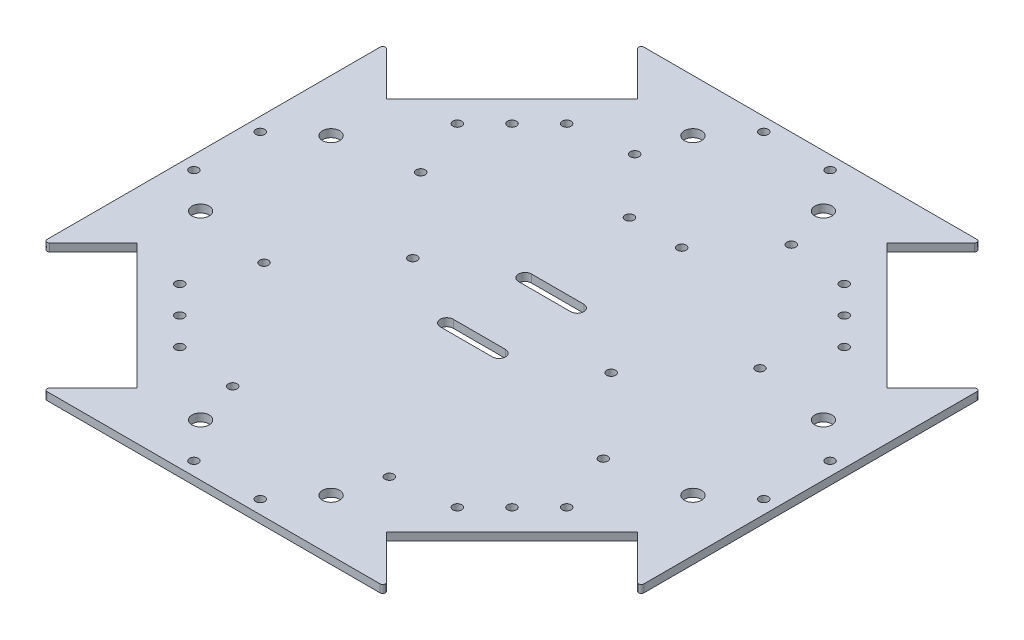
from build123d import *

# Parameters (mm, degrees)
SKETCH1_W                                   = 228.6
SKETCH1_H                                   = 228.6
PLATE_DEPTH                                 = 3
SKETCH8_R                                   = 1.7
MOTOR_MOUNT_HOLES_DEPTH                     = 3
SKETCH9_R                                   = 1.7
CONNECTOR_BOARD_HOLES_DEPTH                 = 3
MOTOR_CONTROLLER_HOLDER_ARDUINO_HOLES_REACH = 163.672
SKETCH11_R                                  = 1.7
CABLE_SLOTS_REACH                           = 163.672
WALL_BRACKET_HOLES_REACH                    = 163.672
SKETCH13_R                                  = 1.7
BATTERY_HOLDER_HOLES_REACH                  = 163.672
SKETCH14_R                                  = 1.7
LOAD_MOUNT_HOLES_REACH                      = 163.672
SKETCH15_R                                  = 3.3
LEVEL2_STANDOFF_HOLES_REACH                 = 163.672
SKETCH10_R                                  = 1.7
WHEEL_SLOTS_DEPTH                           = 3
FILLET1_R                                   = 1


with BuildPart() as part:
    # Sketch1 → plate (new body)
    with BuildSketch(Plane(origin=(0, 0, 0), x_dir=(1, 0, 0), z_dir=(0, 1, 0))):
        Rectangle(SKETCH1_W, SKETCH1_H)
    extrude(amount=PLATE_DEPTH)

    # Sketch8 → motor-mount-holes (cut)
    with BuildSketch(Plane(origin=(0, 3, 0), x_dir=(1, 0, 0), z_dir=(0, 1, 0))):
        with Locations((63.639610307, 63.639610307)):
            Circle(SKETCH8_R)
        with Locations((74.104790668, 53.174429945)):
            Circle(SKETCH8_R)
        with Locations((53.174429945, 74.104790668)):
            Circle(SKETCH8_R)
        with Locations((63.639610307, -63.639610307)):
            Circle(SKETCH8_R)
        with Locations((74.104790668, -53.174429945)):
            Circle(SKETCH8_R)
        with Locations((53.174429945, -74.104790668)):
            Circle(SKETCH8_R)
        with Locations((-63.639610307, -63.639610307)):
            Circle(SKETCH8_R)
        with Locations((-53.174429945, -74.104790668)):
            Circle(SKETCH8_R)
        with Locations((-74.104790668, -53.174429945)):
            Circle(SKETCH8_R)
        with Locations((-63.639610307, 63.639610307)):
            Circle(SKETCH8_R)
        with Locations((-74.104790668, 53.174429945)):
            Circle(SKETCH8_R)
        with Locations((-53.174429945, 74.104790668)):
            Circle(SKETCH8_R)
    extrude(amount=-MOTOR_MOUNT_HOLES_DEPTH, mode=Mode.SUBTRACT)

    # Sketch9 → connector-board-holes (cut)
    with BuildSketch(Plane(origin=(0, 3, 0), x_dir=(1, 0, 0), z_dir=(0, 1, 0))):
        with Locations((-38, 0)):
            Circle(SKETCH9_R)
        with Locations((38, 0)):
            Circle(SKETCH9_R)
    extrude(amount=-CONNECTOR_BOARD_HOLES_DEPTH, mode=Mode.SUBTRACT)

    # Sketch11 → motor-controller-holder-arduino-holes (cut, up to next)
    with BuildSketch(Plane(origin=(0, 3, 0), x_dir=(1, 0, 0), z_dir=(0, 1, 0)), mode=Mode.PRIVATE) as motor_controller_holder_arduino_holes_sk1:
        with Locations((-10, 55)):
            Circle(SKETCH11_R)
    motor_controller_holder_arduino_holes_tool1 = extrude(motor_controller_holder_arduino_holes_sk1.sketch, amount=-MOTOR_CONTROLLER_HOLDER_ARDUINO_HOLES_REACH, mode=Mode.PRIVATE) & part.part
    # Sketch11 → motor-controller-holder-arduino-holes (cut, up to next)
    with BuildSketch(Plane(origin=(0, 3, 0), x_dir=(1, 0, 0), z_dir=(0, 1, 0)), mode=Mode.PRIVATE) as motor_controller_holder_arduino_holes_sk2:
        with Locations((10, 55)):
            Circle(SKETCH11_R)
    motor_controller_holder_arduino_holes_tool2 = extrude(motor_controller_holder_arduino_holes_sk2.sketch, amount=-MOTOR_CONTROLLER_HOLDER_ARDUINO_HOLES_REACH, mode=Mode.PRIVATE) & part.part
    add(motor_controller_holder_arduino_holes_tool1.solids().sort_by_distance((-10, 3, -55))[0], mode=Mode.SUBTRACT)
    add(motor_controller_holder_arduino_holes_tool2.solids().sort_by_distance((10, 3, -55))[0], mode=Mode.SUBTRACT)

    # Sketch12 → cable-slots (cut, up to next)
    with BuildSketch(Plane(origin=(0, 3, 0), x_dir=(1, 0, 0), z_dir=(0, 1, 0)), mode=Mode.PRIVATE) as cable_slots_sk1:
        with BuildLine():
            Line((-10, 17.5), (10, 17.5))
            ThreePointArc((10, 17.5), (12.5, 15), (10, 12.5))
            Line((10, 12.5), (-10, 12.5))
            ThreePointArc((-10, 12.5), (-12.5, 15), (-10, 17.5))
        make_face()
    cable_slots_tool1 = extrude(cable_slots_sk1.sketch, amount=-CABLE_SLOTS_REACH, mode=Mode.PRIVATE) & part.part
    # Sketch12 → cable-slots (cut, up to next)
    with BuildSketch(Plane(origin=(0, 3, 0), x_dir=(1, 0, 0), z_dir=(0, 1, 0)), mode=Mode.PRIVATE) as cable_slots_sk2:
        with BuildLine():
            Line((-10, -12.5), (10, -12.5))
            ThreePointArc((10, -12.5), (12.5, -15), (10, -17.5))
            Line((10, -17.5), (-10, -17.5))
            ThreePointArc((-10, -17.5), (-12.5, -15), (-10, -12.5))
        make_face()
    cable_slots_tool2 = extrude(cable_slots_sk2.sketch, amount=-CABLE_SLOTS_REACH, mode=Mode.PRIVATE) & part.part
    add(cable_slots_tool1.solids().sort_by_distance((0, 3, -15))[0], mode=Mode.SUBTRACT)
    add(cable_slots_tool2.solids().sort_by_distance((0, 3, 15))[0], mode=Mode.SUBTRACT)

    # Sketch13 → wall-bracket-holes (cut, up to next)
    with BuildSketch(Plane(origin=(0, 3, 0), x_dir=(1, 0, 0), z_dir=(0, 1, 0)), mode=Mode.PRIVATE) as wall_bracket_holes_sk1:
        with Locations((-12.7, 109.1438)):
            Circle(SKETCH13_R)
    wall_bracket_holes_tool1 = extrude(wall_bracket_holes_sk1.sketch, amount=-WALL_BRACKET_HOLES_REACH, mode=Mode.PRIVATE) & part.part
    # Sketch13 → wall-bracket-holes (cut, up to next)
    with BuildSketch(Plane(origin=(0, 3, 0), x_dir=(1, 0, 0), z_dir=(0, 1, 0)), mode=Mode.PRIVATE) as wall_bracket_holes_sk2:
        with Locations((12.7, 109.1438)):
            Circle(SKETCH13_R)
    wall_bracket_holes_tool2 = extrude(wall_bracket_holes_sk2.sketch, amount=-WALL_BRACKET_HOLES_REACH, mode=Mode.PRIVATE) & part.part
    # Sketch13 → wall-bracket-holes (cut, up to next)
    with BuildSketch(Plane(origin=(0, 3, 0), x_dir=(1, 0, 0), z_dir=(0, 1, 0)), mode=Mode.PRIVATE) as wall_bracket_holes_sk3:
        with Locations((109.1438, 12.7)):
            Circle(SKETCH13_R)
    wall_bracket_holes_tool3 = extrude(wall_bracket_holes_sk3.sketch, amount=-WALL_BRACKET_HOLES_REACH, mode=Mode.PRIVATE) & part.part
    # Sketch13 → wall-bracket-holes (cut, up to next)
    with BuildSketch(Plane(origin=(0, 3, 0), x_dir=(1, 0, 0), z_dir=(0, 1, 0)), mode=Mode.PRIVATE) as wall_bracket_holes_sk4:
        with Locations((109.1438, -12.7)):
            Circle(SKETCH13_R)
    wall_bracket_holes_tool4 = extrude(wall_bracket_holes_sk4.sketch, amount=-WALL_BRACKET_HOLES_REACH, mode=Mode.PRIVATE) & part.part
    # Sketch13 → wall-bracket-holes (cut, up to next)
    with BuildSketch(Plane(origin=(0, 3, 0), x_dir=(1, 0, 0), z_dir=(0, 1, 0)), mode=Mode.PRIVATE) as wall_bracket_holes_sk5:
        with Locations((12.7, -109.1438)):
            Circle(SKETCH13_R)
    wall_bracket_holes_tool5 = extrude(wall_bracket_holes_sk5.sketch, amount=-WALL_BRACKET_HOLES_REACH, mode=Mode.PRIVATE) & part.part
    # Sketch13 → wall-bracket-holes (cut, up to next)
    with BuildSketch(Plane(origin=(0, 3, 0), x_dir=(1, 0, 0), z_dir=(0, 1, 0)), mode=Mode.PRIVATE) as wall_bracket_holes_sk6:
        with Locations((-12.7, -109.1438)):
            Circle(SKETCH13_R)
    wall_bracket_holes_tool6 = extrude(wall_bracket_holes_sk6.sketch, amount=-WALL_BRACKET_HOLES_REACH, mode=Mode.PRIVATE) & part.part
    # Sketch13 → wall-bracket-holes (cut, up to next)
    with BuildSketch(Plane(origin=(0, 3, 0), x_dir=(1, 0, 0), z_dir=(0, 1, 0)), mode=Mode.PRIVATE) as wall_bracket_holes_sk7:
        with Locations((-109.1438, -12.7)):
            Circle(SKETCH13_R)
    wall_bracket_holes_tool7 = extrude(wall_bracket_holes_sk7.sketch, amount=-WALL_BRACKET_HOLES_REACH, mode=Mode.PRIVATE) & part.part
    # Sketch13 → wall-bracket-holes (cut, up to next)
    with BuildSketch(Plane(origin=(0, 3, 0), x_dir=(1, 0, 0), z_dir=(0, 1, 0)), mode=Mode.PRIVATE) as wall_bracket_holes_sk8:
        with Locations((-109.1438, 12.7)):
            Circle(SKETCH13_R)
    wall_bracket_holes_tool8 = extrude(wall_bracket_holes_sk8.sketch, amount=-WALL_BRACKET_HOLES_REACH, mode=Mode.PRIVATE) & part.part
    add(wall_bracket_holes_tool1.solids().sort_by_distance((-12.7, 3, -109.1438))[0], mode=Mode.SUBTRACT)
    add(wall_bracket_holes_tool2.solids().sort_by_distance((12.7, 3, -109.1438))[0], mode=Mode.SUBTRACT)
    add(wall_bracket_holes_tool3.solids().sort_by_distance((109.1438, 3, -12.7))[0], mode=Mode.SUBTRACT)
    add(wall_bracket_holes_tool4.solids().sort_by_distance((109.1438, 3, 12.7))[0], mode=Mode.SUBTRACT)
    add(wall_bracket_holes_tool5.solids().sort_by_distance((12.7, 3, 109.1438))[0], mode=Mode.SUBTRACT)
    add(wall_bracket_holes_tool6.solids().sort_by_distance((-12.7, 3, 109.1438))[0], mode=Mode.SUBTRACT)
    add(wall_bracket_holes_tool7.solids().sort_by_distance((-109.1438, 3, 12.7))[0], mode=Mode.SUBTRACT)
    add(wall_bracket_holes_tool8.solids().sort_by_distance((-109.1438, 3, -12.7))[0], mode=Mode.SUBTRACT)

    # Sketch14 → battery-holder-holes (cut, up to next)
    with BuildSketch(Plane(origin=(0, 3, 0), x_dir=(1, 0, 0), z_dir=(0, 1, 0)), mode=Mode.PRIVATE) as battery_holder_holes_sk1:
        with Locations((-65, 30)):
            Circle(SKETCH14_R)
    battery_holder_holes_tool1 = extrude(battery_holder_holes_sk1.sketch, amount=-BATTERY_HOLDER_HOLES_REACH, mode=Mode.PRIVATE) & part.part
    # Sketch14 → battery-holder-holes (cut, up to next)
    with BuildSketch(Plane(origin=(0, 3, 0), x_dir=(1, 0, 0), z_dir=(0, 1, 0)), mode=Mode.PRIVATE) as battery_holder_holes_sk2:
        with Locations((-65, -30)):
            Circle(SKETCH14_R)
    battery_holder_holes_tool2 = extrude(battery_holder_holes_sk2.sketch, amount=-BATTERY_HOLDER_HOLES_REACH, mode=Mode.PRIVATE) & part.part
    # Sketch14 → battery-holder-holes (cut, up to next)
    with BuildSketch(Plane(origin=(0, 3, 0), x_dir=(1, 0, 0), z_dir=(0, 1, 0)), mode=Mode.PRIVATE) as battery_holder_holes_sk3:
        with Locations((65, -30)):
            Circle(SKETCH14_R)
    battery_holder_holes_tool3 = extrude(battery_holder_holes_sk3.sketch, amount=-BATTERY_HOLDER_HOLES_REACH, mode=Mode.PRIVATE) & part.part
    # Sketch14 → battery-holder-holes (cut, up to next)
    with BuildSketch(Plane(origin=(0, 3, 0), x_dir=(1, 0, 0), z_dir=(0, 1, 0)), mode=Mode.PRIVATE) as battery_holder_holes_sk4:
        with Locations((65, 30)):
            Circle(SKETCH14_R)
    battery_holder_holes_tool4 = extrude(battery_holder_holes_sk4.sketch, amount=-BATTERY_HOLDER_HOLES_REACH, mode=Mode.PRIVATE) & part.part
    add(battery_holder_holes_tool1.solids().sort_by_distance((-65, 3, -30))[0], mode=Mode.SUBTRACT)
    add(battery_holder_holes_tool2.solids().sort_by_distance((-65, 3, 30))[0], mode=Mode.SUBTRACT)
    add(battery_holder_holes_tool3.solids().sort_by_distance((65, 3, 30))[0], mode=Mode.SUBTRACT)
    add(battery_holder_holes_tool4.solids().sort_by_distance((65, 3, -30))[0], mode=Mode.SUBTRACT)

    # Sketch15 → load-mount-holes (cut, up to next)
    with BuildSketch(Plane(origin=(0, 3, 0), x_dir=(1, 0, 0), z_dir=(0, 1, 0)), mode=Mode.PRIVATE) as load_mount_holes_sk1:
        with Locations((-94.3, 25)):
            Circle(SKETCH15_R)
    load_mount_holes_tool1 = extrude(load_mount_holes_sk1.sketch, amount=-LOAD_MOUNT_HOLES_REACH, mode=Mode.PRIVATE) & part.part
    # Sketch15 → load-mount-holes (cut, up to next)
    with BuildSketch(Plane(origin=(0, 3, 0), x_dir=(1, 0, 0), z_dir=(0, 1, 0)), mode=Mode.PRIVATE) as load_mount_holes_sk2:
        with Locations((-94.3, -25)):
            Circle(SKETCH15_R)
    load_mount_holes_tool2 = extrude(load_mount_holes_sk2.sketch, amount=-LOAD_MOUNT_HOLES_REACH, mode=Mode.PRIVATE) & part.part
    # Sketch15 → load-mount-holes (cut, up to next)
    with BuildSketch(Plane(origin=(0, 3, 0), x_dir=(1, 0, 0), z_dir=(0, 1, 0)), mode=Mode.PRIVATE) as load_mount_holes_sk3:
        with Locations((94.3, 25)):
            Circle(SKETCH15_R)
    load_mount_holes_tool3 = extrude(load_mount_holes_sk3.sketch, amount=-LOAD_MOUNT_HOLES_REACH, mode=Mode.PRIVATE) & part.part
    # Sketch15 → load-mount-holes (cut, up to next)
    with BuildSketch(Plane(origin=(0, 3, 0), x_dir=(1, 0, 0), z_dir=(0, 1, 0)), mode=Mode.PRIVATE) as load_mount_holes_sk4:
        with Locations((94.3, -25)):
            Circle(SKETCH15_R)
    load_mount_holes_tool4 = extrude(load_mount_holes_sk4.sketch, amount=-LOAD_MOUNT_HOLES_REACH, mode=Mode.PRIVATE) & part.part
    # Sketch15 → load-mount-holes (cut, up to next)
    with BuildSketch(Plane(origin=(0, 3, 0), x_dir=(1, 0, 0), z_dir=(0, 1, 0)), mode=Mode.PRIVATE) as load_mount_holes_sk5:
        with Locations((25, 94.3)):
            Circle(SKETCH15_R)
    load_mount_holes_tool5 = extrude(load_mount_holes_sk5.sketch, amount=-LOAD_MOUNT_HOLES_REACH, mode=Mode.PRIVATE) & part.part
    # Sketch15 → load-mount-holes (cut, up to next)
    with BuildSketch(Plane(origin=(0, 3, 0), x_dir=(1, 0, 0), z_dir=(0, 1, 0)), mode=Mode.PRIVATE) as load_mount_holes_sk6:
        with Locations((-25, 94.3)):
            Circle(SKETCH15_R)
    load_mount_holes_tool6 = extrude(load_mount_holes_sk6.sketch, amount=-LOAD_MOUNT_HOLES_REACH, mode=Mode.PRIVATE) & part.part
    # Sketch15 → load-mount-holes (cut, up to next)
    with BuildSketch(Plane(origin=(0, 3, 0), x_dir=(1, 0, 0), z_dir=(0, 1, 0)), mode=Mode.PRIVATE) as load_mount_holes_sk7:
        with Locations((25, -94.3)):
            Circle(SKETCH15_R)
    load_mount_holes_tool7 = extrude(load_mount_holes_sk7.sketch, amount=-LOAD_MOUNT_HOLES_REACH, mode=Mode.PRIVATE) & part.part
    # Sketch15 → load-mount-holes (cut, up to next)
    with BuildSketch(Plane(origin=(0, 3, 0), x_dir=(1, 0, 0), z_dir=(0, 1, 0)), mode=Mode.PRIVATE) as load_mount_holes_sk8:
        with Locations((-25, -94.3)):
            Circle(SKETCH15_R)
    load_mount_holes_tool8 = extrude(load_mount_holes_sk8.sketch, amount=-LOAD_MOUNT_HOLES_REACH, mode=Mode.PRIVATE) & part.part
    add(load_mount_holes_tool1.solids().sort_by_distance((-94.3, 3, -25))[0], mode=Mode.SUBTRACT)
    add(load_mount_holes_tool2.solids().sort_by_distance((-94.3, 3, 25))[0], mode=Mode.SUBTRACT)
    add(load_mount_holes_tool3.solids().sort_by_distance((94.3, 3, -25))[0], mode=Mode.SUBTRACT)
    add(load_mount_holes_tool4.solids().sort_by_distance((94.3, 3, 25))[0], mode=Mode.SUBTRACT)
    add(load_mount_holes_tool5.solids().sort_by_distance((25, 3, -94.3))[0], mode=Mode.SUBTRACT)
    add(load_mount_holes_tool6.solids().sort_by_distance((-25, 3, -94.3))[0], mode=Mode.SUBTRACT)
    add(load_mount_holes_tool7.solids().sort_by_distance((25, 3, 94.3))[0], mode=Mode.SUBTRACT)
    add(load_mount_holes_tool8.solids().sort_by_distance((-25, 3, 94.3))[0], mode=Mode.SUBTRACT)

    # Sketch10 → level2-standoff-holes (cut, up to next)
    with BuildSketch(Plane(origin=(0, 3, 0), x_dir=(1, 0, 0), z_dir=(0, 1, 0)), mode=Mode.PRIVATE) as level2_standoff_holes_sk1:
        with Locations((30, 77)):
            Circle(SKETCH10_R)
    level2_standoff_holes_tool1 = extrude(level2_standoff_holes_sk1.sketch, amount=-LEVEL2_STANDOFF_HOLES_REACH, mode=Mode.PRIVATE) & part.part
    # Sketch10 → level2-standoff-holes (cut, up to next)
    with BuildSketch(Plane(origin=(0, 3, 0), x_dir=(1, 0, 0), z_dir=(0, 1, 0)), mode=Mode.PRIVATE) as level2_standoff_holes_sk2:
        with Locations((30, -77)):
            Circle(SKETCH10_R)
    level2_standoff_holes_tool2 = extrude(level2_standoff_holes_sk2.sketch, amount=-LEVEL2_STANDOFF_HOLES_REACH, mode=Mode.PRIVATE) & part.part
    # Sketch10 → level2-standoff-holes (cut, up to next)
    with BuildSketch(Plane(origin=(0, 3, 0), x_dir=(1, 0, 0), z_dir=(0, 1, 0)), mode=Mode.PRIVATE) as level2_standoff_holes_sk3:
        with Locations((-30, -77)):
            Circle(SKETCH10_R)
    level2_standoff_holes_tool3 = extrude(level2_standoff_holes_sk3.sketch, amount=-LEVEL2_STANDOFF_HOLES_REACH, mode=Mode.PRIVATE) & part.part
    # Sketch10 → level2-standoff-holes (cut, up to next)
    with BuildSketch(Plane(origin=(0, 3, 0), x_dir=(1, 0, 0), z_dir=(0, 1, 0)), mode=Mode.PRIVATE) as level2_standoff_holes_sk4:
        with Locations((-30, 77)):
            Circle(SKETCH10_R)
    level2_standoff_holes_tool4 = extrude(level2_standoff_holes_sk4.sketch, amount=-LEVEL2_STANDOFF_HOLES_REACH, mode=Mode.PRIVATE) & part.part
    add(level2_standoff_holes_tool1.solids().sort_by_distance((30, 3, -77))[0], mode=Mode.SUBTRACT)
    add(level2_standoff_holes_tool2.solids().sort_by_distance((30, 3, 77))[0], mode=Mode.SUBTRACT)
    add(level2_standoff_holes_tool3.solids().sort_by_distance((-30, 3, 77))[0], mode=Mode.SUBTRACT)
    add(level2_standoff_holes_tool4.solids().sort_by_distance((-30, 3, -77))[0], mode=Mode.SUBTRACT)

    # Sketch2 → wheel-slots (cut)
    with BuildSketch(Plane(origin=(0, 3, 0), x_dir=(1, 0, 0), z_dir=(0, 1, 0))):
        Polygon((114.3, 114.3), (66.216738879, 114.3), (47.800418408, 95.883679529), (95.883679529, 47.800418408), (114.3, 66.216738879), align=None)
        Polygon((66.216738879, -114.3), (114.3, -114.3), (114.3, -66.216738879), (95.883679529, -47.800418408), (47.800418408, -95.883679529), align=None)
        Polygon((-114.3, -66.216738879), (-114.3, -114.3), (-66.216738879, -114.3), (-47.800418408, -95.883679529), (-95.883679529, -47.800418408), align=None)
        Polygon((-66.216738879, 114.3), (-114.3, 114.3), (-114.3, 66.216738879), (-95.883679529, 47.800418408), (-47.800418408, 95.883679529), align=None)
    extrude(amount=-WHEEL_SLOTS_DEPTH, mode=Mode.SUBTRACT)

    # Fillet1
    fillet1_edges = [part.edges().sort_by_distance(p)[0] for p in [
        (66.216738879, 1.5, -114.3),
        (114.3, 1.5, -66.216738879),
        (114.3, 1.5, 66.216738879),
        (-66.216738879, 1.5, -114.3),
        (-114.3, 1.5, -66.216738879),
        (-114.3, 1.5, 66.216738879),
        (-66.216738879, 1.5, 114.3),
        (66.216738879, 1.5, 114.3),
    ]]
    fillet(fillet1_edges, radius=FILLET1_R)


solid = part.part
